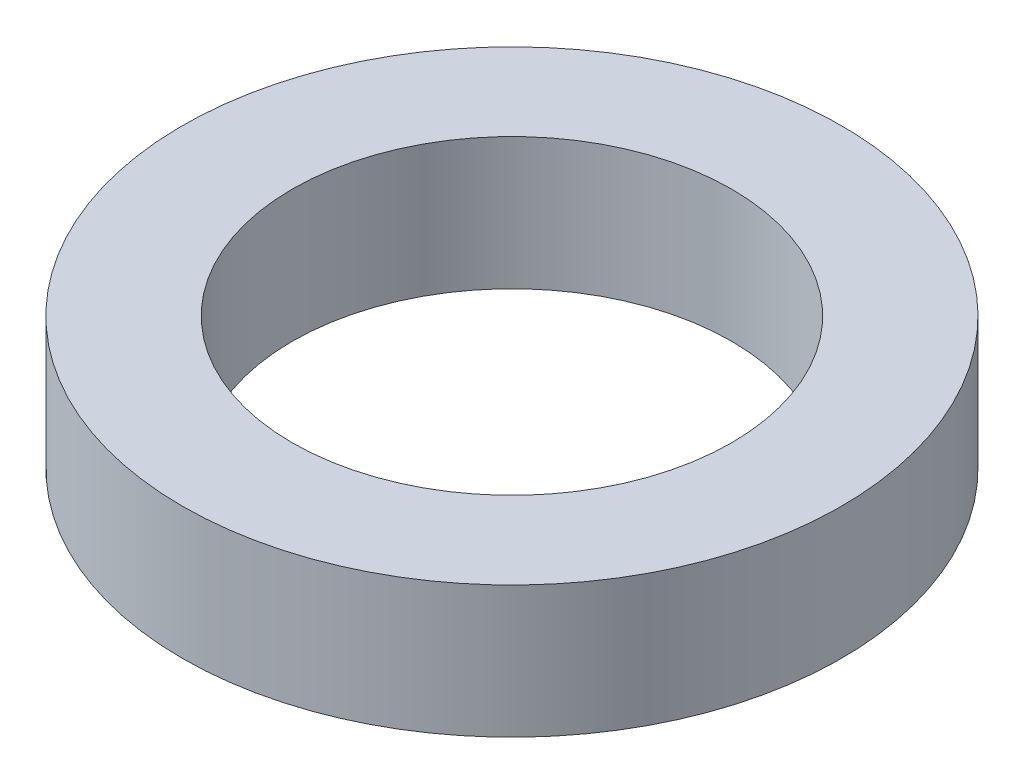
from build123d import *

# Parameters (mm, degrees)
SKETCH1_R           = 45
BOSS_EXTRUDE1_DEPTH = 18
SKETCH2_R           = 30
CUT_EXTRUDE1_DEPTH  = 67.136223055


with BuildPart() as part:
    # Sketch1 → Boss-Extrude1 (new body)
    with BuildSketch(Plane(origin=(0, 0, 0), x_dir=(1, 0, 0), z_dir=(0, 1, 0))):
        Circle(SKETCH1_R)
    extrude(amount=BOSS_EXTRUDE1_DEPTH)

    # Sketch2 → Cut-Extrude1 (cut, through all)
    with BuildSketch(Plane(origin=(0, 0, 0), x_dir=(1, 0, 0), z_dir=(0, 1, 0))):
        Circle(SKETCH2_R)
    extrude(amount=CUT_EXTRUDE1_DEPTH, mode=Mode.SUBTRACT)


solid = part.part
